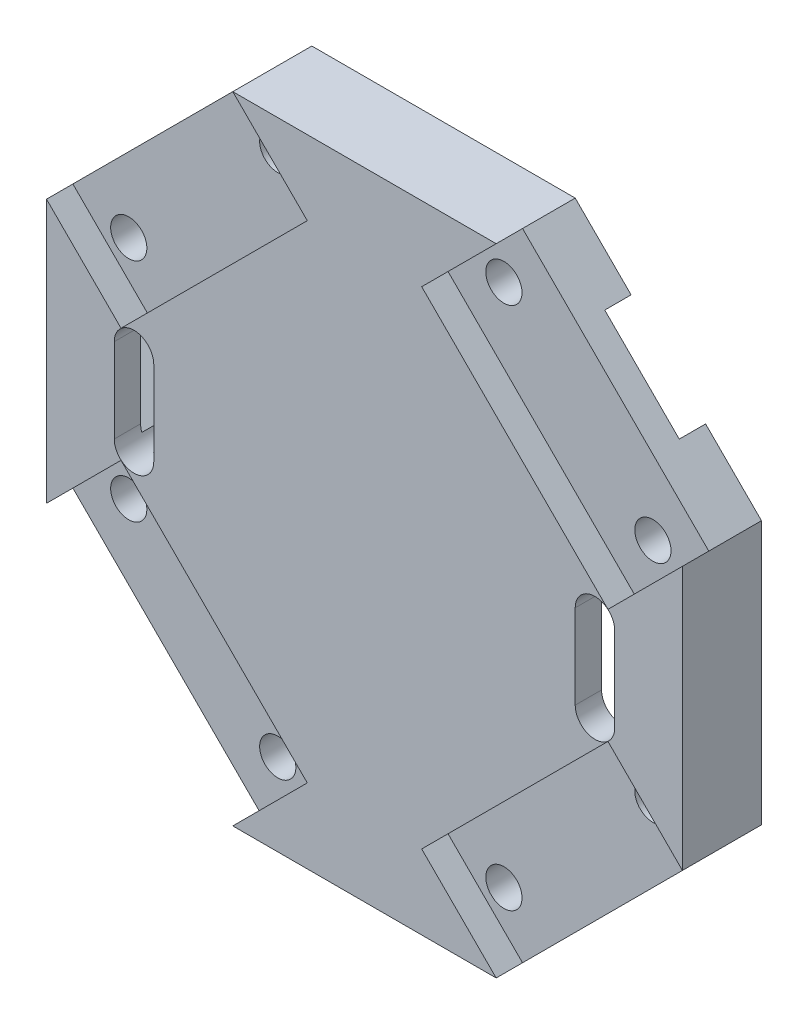
from build123d import *

# Parameters (mm, degrees)
BOSS_EXTRUDE1_DEPTH = 19.05
SKETCH3_R           = 2.1828125
CUT_EXTRUDE2_DEPTH  = 58.450952205
SKETCH6_W           = 9.525
SKETCH6_H           = 76.651280606
CUT_EXTRUDE3_DEPTH  = 95.467005365
CUT_EXTRUDE4_DEPTH  = 6.35
SKETCH7_W           = 3.175
SKETCH7_H           = 12.7
CUT_EXTRUDE5_DEPTH  = 94.015258037
CIRPATTERN1_COUNT   = 2
CIRPATTERN1_ANGLE   = 90
CUT_EXTRUDE7_DEPTH  = 3.175
CUT_EXTRUDE8_DEPTH  = 56.031218724


with BuildPart() as part:
    # Sketch1 → Boss-Extrude1 (new body)
    with BuildSketch(Plane.XY):
        Polygon((-38.325640303, 15.875), (-38.325640303, -15.875), (-15.875, -38.325640303), (15.875, -38.325640303), (38.325640303, -15.875), (38.325640303, 15.875), (15.875, 38.325640303), (-15.875, 38.325640303), align=None)
    extrude(amount=BOSS_EXTRUDE1_DEPTH)

    # Sketch3 → Cut-Extrude2 (cut, through all)
    with BuildSketch(Plane.XY.offset(19.05)):
        with Locations((-13.62993597, 31.590448212)):
            Circle(SKETCH3_R)
        with Locations((31.590448212, -13.62993597)):
            Circle(SKETCH3_R)
        with Locations((13.62993597, -31.590448212)):
            Circle(SKETCH3_R)
        with Locations((-13.62993597, -31.590448212)):
            Circle(SKETCH3_R)
        with Locations((-31.590448212, 13.62993597)):
            Circle(SKETCH3_R)
        with Locations((13.62993597, 31.590448212)):
            Circle(SKETCH3_R)
        with Locations((31.590448212, 13.62993597)):
            Circle(SKETCH3_R)
        with Locations((-31.590448212, -13.62993597)):
            Circle(SKETCH3_R)
    extrude(amount=-CUT_EXTRUDE2_DEPTH, mode=Mode.SUBTRACT)

    # Sketch6 → Cut-Extrude3 (cut, through all)
    with BuildSketch(Plane(origin=(-27.100320151, -27.100320151, 0), x_dir=(0, 0, 1), z_dir=(-0.7071067811865476, -0.7071067811865476, 0))):
        with Locations((14.2875, 0)):
            Rectangle(SKETCH6_W, SKETCH6_H)
    extrude(amount=-CUT_EXTRUDE3_DEPTH, mode=Mode.SUBTRACT)

    # Sketch5 → Cut-Extrude4 (cut)
    with BuildSketch(Plane(origin=(0, 0, 0), x_dir=(-1, 0, 0), z_dir=(0, 0, -1))):
        Polygon((0, -35.921024484), (35.921024484, 0), (0, 35.921024484), (-35.921024484, 0), align=None)
    extrude(amount=-CUT_EXTRUDE4_DEPTH, mode=Mode.SUBTRACT)

    # Sketch7 → Cut-Extrude5 (cut, through all)
    with BuildSketch(Plane(origin=(27.100320151, 27.100320151, 0), x_dir=(0, 0, -1), z_dir=(0.7071067811865475, 0.7071067811865477, 0))):
        with Locations((-1.5875, 0)):
            Rectangle(SKETCH7_W, SKETCH7_H)
    cut_extrude5 = extrude(amount=-CUT_EXTRUDE5_DEPTH, mode=Mode.SUBTRACT)

    # CirPattern1: Cut-Extrude5 ×2 about axis
    cirpattern1_axis = Axis((0, 0, 8.334375), (0, 0, -1))
    for i in range(1, CIRPATTERN1_COUNT):
        add(cut_extrude5.rotate(cirpattern1_axis, i * CIRPATTERN1_ANGLE / (CIRPATTERN1_COUNT - 1)), mode=Mode.SUBTRACT)

    # Sketch13 → Cut-Extrude7 (cut)
    with BuildSketch(Plane.XY.offset(9.525)):
        Polygon((-38.325640303, -15.875), (-15.875, -38.325640303), (-6.894743879, -29.345384182), (-29.345384182, -6.894743879), align=None)
        Polygon((15.875, -38.325640303), (6.894743879, -29.345384182), (29.345384182, -6.894743879), (38.325640303, -15.875), align=None)
        Polygon((38.325640303, 15.875), (15.875, 38.325640303), (6.894743879, 29.345384182), (29.345384182, 6.894743879), align=None)
        Polygon((-29.345384182, 6.894743879), (-6.894743879, 29.345384182), (-15.875, 38.325640303), (-38.325640303, 15.875), align=None)
    extrude(amount=-CUT_EXTRUDE7_DEPTH, mode=Mode.SUBTRACT)

    # Sketch15 → Cut-Extrude8 (cut, through all)
    with BuildSketch(Plane.XY.offset(9.525)):
        with BuildLine():
            Line((-30.1625, -5.08), (-30.1625, 5.08))
            ThreePointArc((-30.1625, 5.08), (-27.78125, 7.46125), (-25.4, 5.08))
            Line((-25.4, 5.08), (-25.4, -5.08))
            ThreePointArc((-25.4, -5.08), (-27.78125, -7.46125), (-30.1625, -5.08))
        make_face()
        with BuildLine():
            Line((30.1625, -5.08), (30.1625, 5.08))
            ThreePointArc((30.1625, 5.08), (27.78125, 7.46125), (25.4, 5.08))
            Line((25.4, 5.08), (25.4, -5.08))
            ThreePointArc((25.4, -5.08), (27.78125, -7.46125), (30.1625, -5.08))
        make_face()
    extrude(amount=-CUT_EXTRUDE8_DEPTH, mode=Mode.SUBTRACT)


solid = part.part
